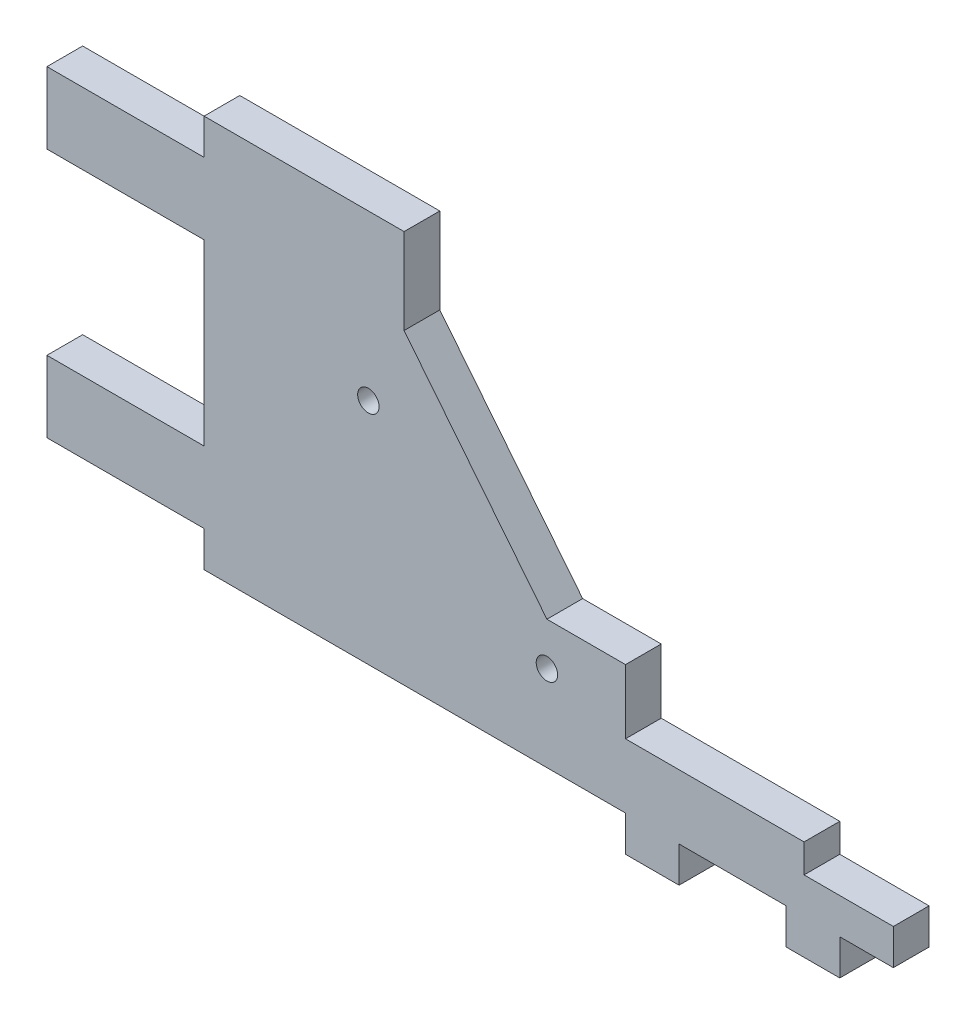
from build123d import *

# Parameters (mm, degrees)
ESQUISSE1_R        = 1.5
BOSS_EXTRU_1_DEPTH = 5
BOSS_EXTRU_2_DEPTH = 5


with BuildPart() as part:
    # Esquisse1 → Boss.-Extru.1 (new body)
    with BuildSketch(Plane.XY):
        Polygon((11, 43), (31, 18), (37, 18), (37, 0), (0, 0), (0, 55), (11, 55), align=None)
        with Locations((6, 32)):
            Circle(ESQUISSE1_R, mode=Mode.SUBTRACT)
        with Locations((31, 12)):
            Circle(ESQUISSE1_R, mode=Mode.SUBTRACT)
    extrude(amount=BOSS_EXTRU_1_DEPTH)

    # Esquisse2 → Boss.-Extru.2 (add)
    with BuildSketch(Plane.XY.offset(5)):
        Polygon((37, 0), (42, 0), (42, -5), (49.5, -5), (49.5, 0), (64.5, 0), (64.5, -5), (72, -5), (72, 0), (79.5, 0), (79.5, 5), (67, 5), (67, 9), (42, 9), (42, 18), (37, 18), align=None)
        Polygon((0, 0), (-17, 0), (-17, 5), (-39, 5), (-39, 15), (-17, 15), (-17, 40), (-39, 40), (-39, 50), (-17, 50), (-17, 55), (0, 55), align=None)
    extrude(amount=-BOSS_EXTRU_2_DEPTH)


solid = part.part
